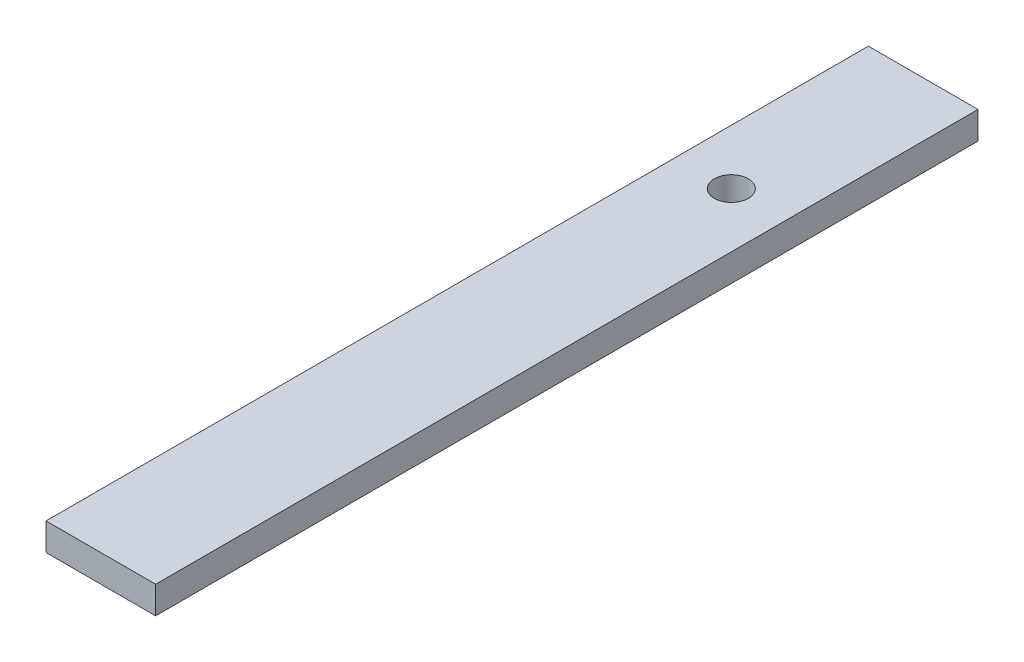
from build123d import *

# Parameters (mm, degrees)
SKETCH1_W           = 50.8
SKETCH1_H           = 381
SKETCH1_R           = 7.874
BOSS_EXTRUDE1_DEPTH = 12.7


with BuildPart() as part:
    # Sketch1 → Boss-Extrude1 (new body)
    with BuildSketch(Plane(origin=(0, 0, 0), x_dir=(1, 0, 0), z_dir=(0, 1, 0))):
        with Locations((25.4, 190.5)):
            Rectangle(SKETCH1_W, SKETCH1_H)
        with Locations((25.4, 292.1)):
            Circle(SKETCH1_R, mode=Mode.SUBTRACT)
    extrude(amount=BOSS_EXTRUDE1_DEPTH)


solid = part.part
